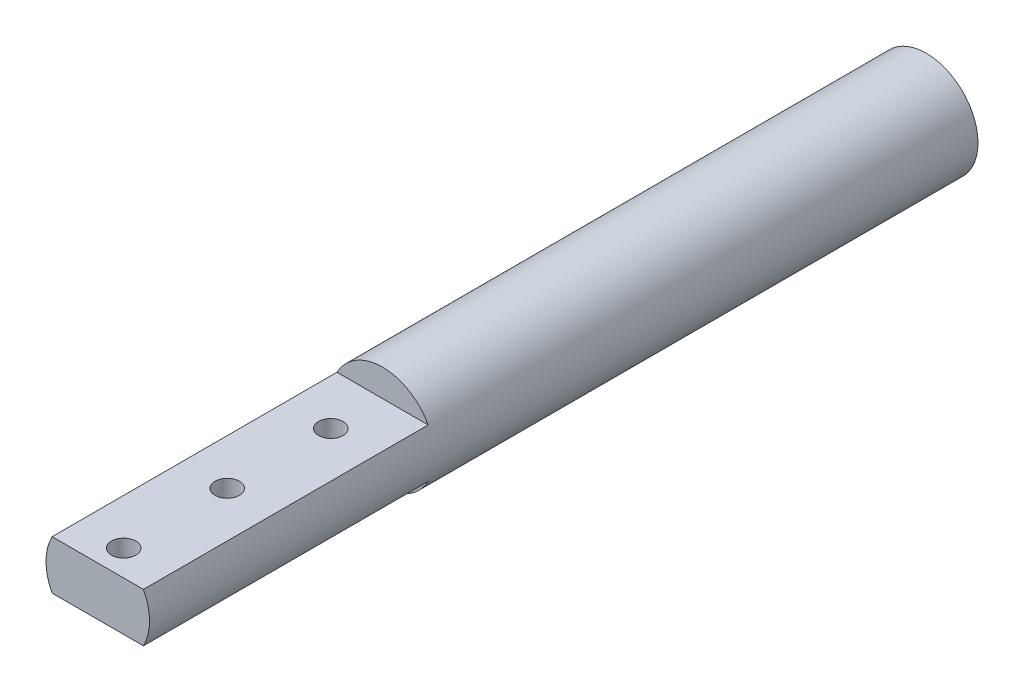
from build123d import *

# Parameters (mm, degrees)
SKETCH1_R           = 6.35
BOSS_EXTRUDE1_DEPTH = 50.8
CUT_EXTRUDE1_DEPTH  = 34.925
CUT_EXTRUDE2_REACH  = 54.042
SKETCH3_R           = 1.5


with BuildPart() as part:
    # Sketch1 → Boss-Extrude1 (new, symmetric)
    with BuildSketch(Plane.XY):
        Circle(SKETCH1_R)
    extrude(amount=BOSS_EXTRUDE1_DEPTH, both=True)

    # Sketch2 → Cut-Extrude1 (cut)
    with BuildSketch(Plane.XY.offset(50.8)):
        with BuildLine():
            ThreePointArc((5.596650784, 3), (0, 6.35), (-5.596650784, 3))
            Line((-5.596650784, 3), (5.596650784, 3))
        make_face()
        with BuildLine():
            Line((5.596650784, -3), (-5.596650784, -3))
            ThreePointArc((-5.596650784, -3), (0, -6.35), (5.596650784, -3))
        make_face()
    extrude(amount=-CUT_EXTRUDE1_DEPTH, mode=Mode.SUBTRACT)

    # Sketch3 → Cut-Extrude2 (cut, up to next)
    with BuildSketch(Plane(origin=(0, 3, 0), x_dir=(1, 0, 0), z_dir=(0, 1, 0)), mode=Mode.PRIVATE) as cut_extrude2_sk1:
        with Locations((0, -22.225)):
            Circle(SKETCH3_R)
    cut_extrude2_tool1 = extrude(cut_extrude2_sk1.sketch, amount=-CUT_EXTRUDE2_REACH, mode=Mode.PRIVATE) & part.part
    # Sketch3 → Cut-Extrude2 (cut, up to next)
    with BuildSketch(Plane(origin=(0, 3, 0), x_dir=(1, 0, 0), z_dir=(0, 1, 0)), mode=Mode.PRIVATE) as cut_extrude2_sk2:
        with Locations((0, -34.925)):
            Circle(SKETCH3_R)
    cut_extrude2_tool2 = extrude(cut_extrude2_sk2.sketch, amount=-CUT_EXTRUDE2_REACH, mode=Mode.PRIVATE) & part.part
    # Sketch3 → Cut-Extrude2 (cut, up to next)
    with BuildSketch(Plane(origin=(0, 3, 0), x_dir=(1, 0, 0), z_dir=(0, 1, 0)), mode=Mode.PRIVATE) as cut_extrude2_sk3:
        with Locations((0, -47.625)):
            Circle(SKETCH3_R)
    cut_extrude2_tool3 = extrude(cut_extrude2_sk3.sketch, amount=-CUT_EXTRUDE2_REACH, mode=Mode.PRIVATE) & part.part
    add(cut_extrude2_tool1.solids().sort_by_distance((0, 3, 22.225))[0], mode=Mode.SUBTRACT)
    add(cut_extrude2_tool2.solids().sort_by_distance((0, 3, 34.925))[0], mode=Mode.SUBTRACT)
    add(cut_extrude2_tool3.solids().sort_by_distance((0, 3, 47.625))[0], mode=Mode.SUBTRACT)


solid = part.part
